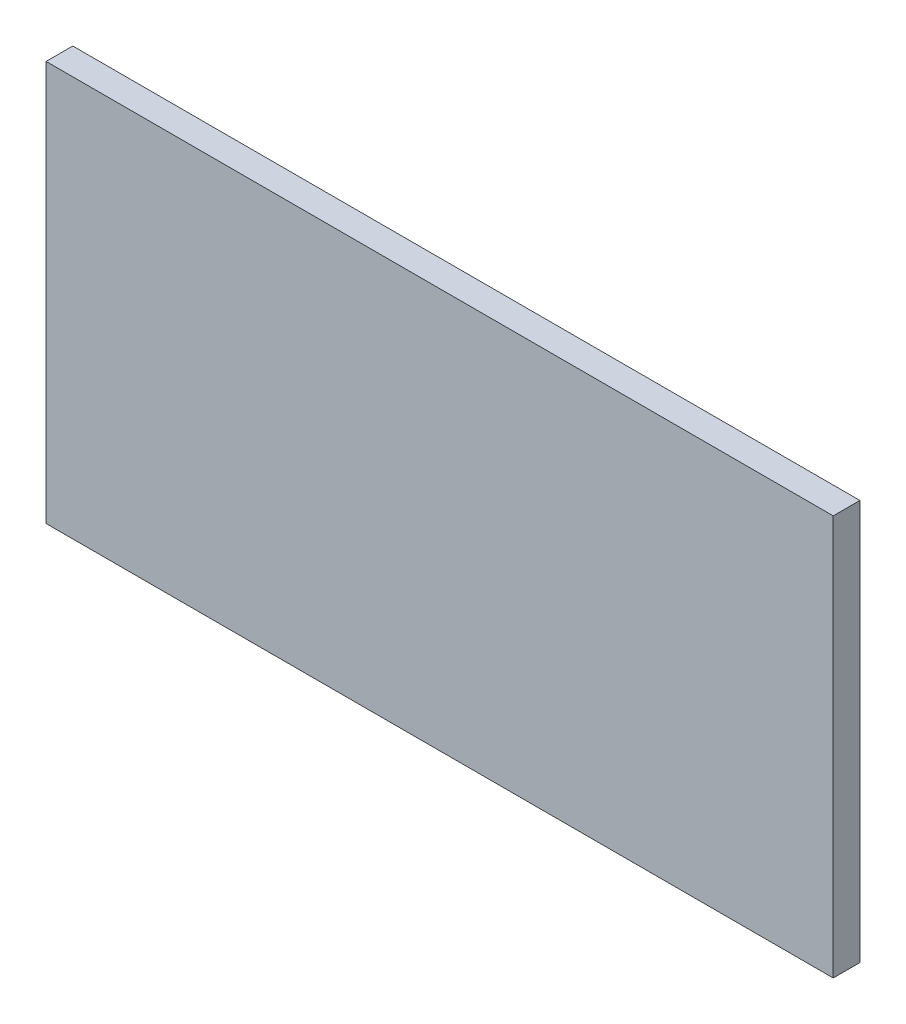
from build123d import *

# Parameters (mm, degrees)
SKETCH1_W           = 59
SKETCH1_H           = 30
BOSS_EXTRUDE1_DEPTH = 2


with BuildPart() as part:
    # Sketch1 → Boss-Extrude1 (new body)
    with BuildSketch(Plane.XY):
        Rectangle(SKETCH1_W, SKETCH1_H)
    extrude(amount=BOSS_EXTRUDE1_DEPTH)


solid = part.part
